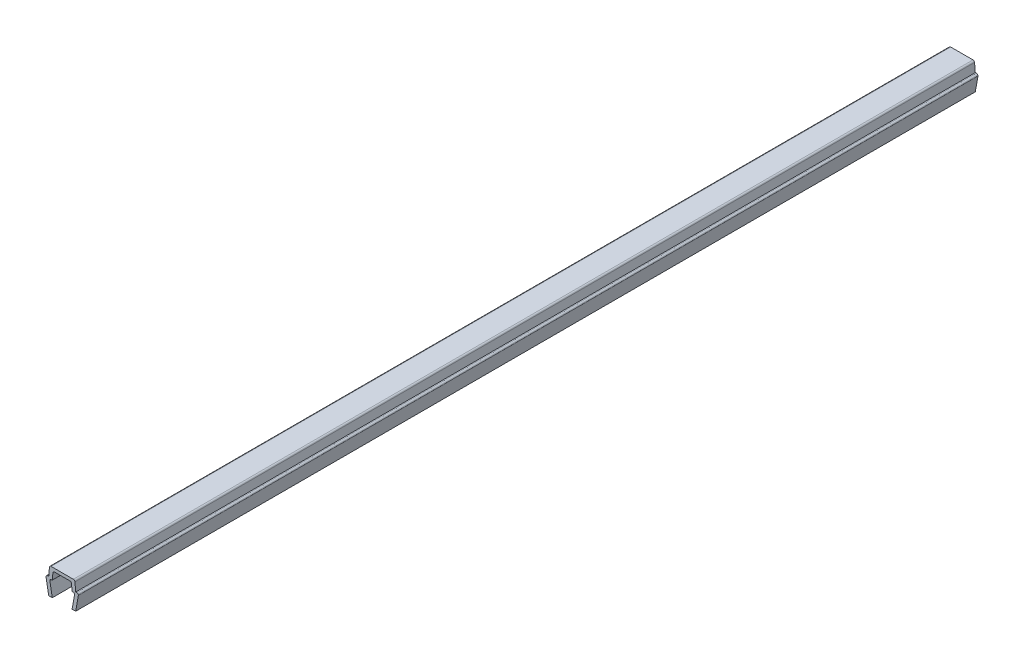
from build123d import *

# Parameters (mm, degrees)
BOSS_EXTRUDE1_DEPTH = 100


with BuildPart() as part:
    # Sketch1 → Boss-Extrude1 (new, symmetric)
    with BuildSketch(Plane.XY):
        with BuildLine():
            Line((-3.6, 3.35), (-3, 0))
            Line((-3, 0), (-2.2, 0))
            Line((-2.2, 0), (-2.735217071, 2.988295315))
            ThreePointArc((-2.735217071, 2.988295315), (-2.659117427, 3.274614514), (-2.390699246, 3.4))
            Line((-2.390699246, 3.4), (-2.2, 3.4))
            Line((-2.2, 3.4), (-2.070472639, 4.88050451))
            ThreePointArc((-2.070472639, 4.88050451), (-1.958261067, 5.108047068), (-1.721804495, 5.2))
            Line((-1.721804495, 5.2), (1.721804495, 5.2))
            ThreePointArc((1.721804495, 5.2), (1.958261067, 5.108047068), (2.070472639, 4.88050451))
            Line((2.070472639, 4.88050451), (2.2, 3.4))
            Line((2.2, 3.4), (2.390699246, 3.4))
            ThreePointArc((2.390699246, 3.4), (2.659117427, 3.274614514), (2.735217071, 2.988295315))
            Line((2.735217071, 2.988295315), (2.2, 0))
            Line((2.2, 0), (3, 0))
            Line((3, 0), (3.6, 3.35))
            ThreePointArc((3.6, 3.35), (3.497487373, 3.597487373), (3.25, 3.7))
            Line((3.25, 3.7), (3, 3.7))
            Line((3, 3.7), (2.835477174, 5.58050451))
            ThreePointArc((2.835477174, 5.58050451), (2.723265602, 5.808047068), (2.486809029, 5.9))
            Line((2.486809029, 5.9), (-2.486809029, 5.9))
            ThreePointArc((-2.486809029, 5.9), (-2.723265602, 5.808047068), (-2.835477174, 5.58050451))
            Line((-2.835477174, 5.58050451), (-3, 3.7))
            Line((-3, 3.7), (-3.25, 3.7))
            ThreePointArc((-3.25, 3.7), (-3.497487373, 3.597487373), (-3.6, 3.35))
        make_face()
    extrude(amount=BOSS_EXTRUDE1_DEPTH, both=True)


solid = part.part
